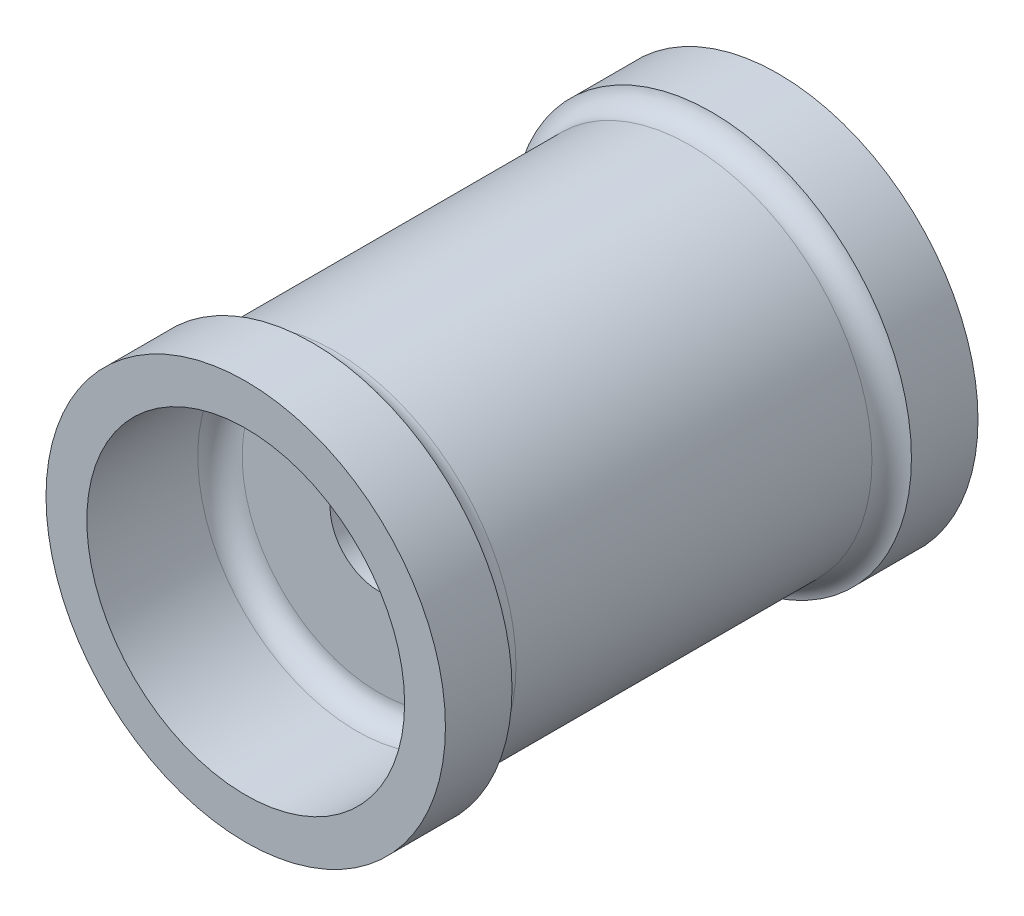
from build123d import *

# Parameters (mm, degrees)
SZKIC1_R                    = 8.2
SZKIC1_R_2                  = 2.2
DODANIE_WYCI_GNI_CIE6_DEPTH = 18
SZKIC6_R                    = 9
SZKIC6_R_2                  = 2.2
DODANIE_WYCI_GNI_CIE7_DEPTH = 3
DODANIE_WYCI_GNI_CIE8_START = 3
SZKIC7_R                    = 9
SZKIC7_R_2                  = 2.2
DODANIE_WYCI_GNI_CIE8_DEPTH = 3
SZKIC8_R                    = 7.16
WYTNIJ_WYCI_GNI_CIE2_DEPTH  = 6
WYTNIJ_WYCI_GNI_CIE3_START  = -6
SZKIC9_R                    = 7.16
SZKIC9_R_2                  = 2.2
WYTNIJ_WYCI_GNI_CIE3_DEPTH  = 6
ZAOKR_GLENIE2_R             = 1
ZAOKR_GLENIE3_R             = 1
ZAOKR_GLENIE4_R             = 1


with BuildPart() as part:
    # Szkic1 → Dodanie-wyciągnięcie6 (new body)
    with BuildSketch(Plane.XY):
        Circle(SZKIC1_R)
        Circle(SZKIC1_R_2, mode=Mode.SUBTRACT)
    extrude(amount=DODANIE_WYCI_GNI_CIE6_DEPTH)

    # Szkic6 → Dodanie-wyciągnięcie7 (add)
    with BuildSketch(Plane.XY.offset(18)):
        Circle(SZKIC6_R)
        Circle(SZKIC6_R_2, mode=Mode.SUBTRACT)
    extrude(amount=DODANIE_WYCI_GNI_CIE7_DEPTH)

    # Szkic7 → Dodanie-wyciągnięcie8 (add)
    with BuildSketch(Plane(origin=(0, 0, 0), x_dir=(-1, 0, 0), z_dir=(0, 0, -1)).offset(DODANIE_WYCI_GNI_CIE8_START)):
        with Locations(Location((0, 0, 0), (0, 0, 180))):
            Circle(SZKIC7_R)
        Circle(SZKIC7_R_2, mode=Mode.SUBTRACT)
    extrude(amount=-DODANIE_WYCI_GNI_CIE8_DEPTH)

    # Szkic8 → Wytnij-wyciągnięcie2 (cut)
    with BuildSketch(Plane(origin=(0, 0, -3), x_dir=(-1, 0, 0), z_dir=(0, 0, -1))):
        Circle(SZKIC8_R)
    extrude(amount=-WYTNIJ_WYCI_GNI_CIE2_DEPTH, mode=Mode.SUBTRACT)

    # Szkic9 → Wytnij-wyciągnięcie3 (cut)
    with BuildSketch(Plane.XY.offset(21).offset(WYTNIJ_WYCI_GNI_CIE3_START)):
        with Locations(Location((0, 0, 0), (0, 0, 180))):
            Circle(SZKIC9_R)
        with Locations(Location((0, 0, 0), (0, 0, 180))):
            Circle(SZKIC9_R_2, mode=Mode.SUBTRACT)
    extrude(amount=WYTNIJ_WYCI_GNI_CIE3_DEPTH, mode=Mode.SUBTRACT)

    # Zaokrąglenie2
    # the kernel refuses this fillet: 1 mm, written as the material it adds along each edge
    with BuildSketch(Plane(origin=(0, 0, 0), x_dir=(1, 0, 0), z_dir=(0, -1, 0))) as zaokr_glenie2_piece_1:
        with BuildLine():
            CenterArc((9.2, 0.979795897), ZAOKR_GLENIE2_R, 180, 78.463040967)
            Line((9, 0), (8.996, -0.019595918))
            ThreePointArc((8.996, -0.019595918), (8.6, -0.02), (8.2, -0.02))
            Line((8.2, -0.02), (8.18, 0))
            Line((8.18, 0), (8.18, 0.979795897))
            Line((8.18, 0.979795897), (8.2, 0.979795897))
        make_face()
    revolve(axis=Axis((0, 0, 0), (0, 0, 1)))
    with BuildSketch(Plane(origin=(0, 0, 18), x_dir=(1, 0, 0), z_dir=(0, -1, 0))) as zaokr_glenie2_piece_2:
        with BuildLine():
            CenterArc((9.2, -0.979795897), ZAOKR_GLENIE2_R, 101.536959033, 78.463040967)
            Line((9, 0), (8.996, 0.019595918))
            ThreePointArc((8.996, 0.019595918), (8.6, 0.02), (8.2, 0.02))
            Line((8.2, 0.02), (8.18, 0))
            Line((8.18, 0), (8.18, -0.979795897))
            Line((8.18, -0.979795897), (8.2, -0.979795897))
        make_face()
    revolve(axis=Axis((0, 0, 18), (0, 0, 1)))

    # Zaokrąglenie3
    zaokr_glenie3_edges = [part.edges().sort_by_distance(p)[0] for p in [
        (7.16, 0, 3),
    ]]
    fillet(zaokr_glenie3_edges, radius=ZAOKR_GLENIE3_R)

    # Zaokrąglenie4
    zaokr_glenie4_edges = [part.edges().sort_by_distance(p)[0] for p in [
        (7.16, 0, 15),
    ]]
    fillet(zaokr_glenie4_edges, radius=ZAOKR_GLENIE4_R)


solid = part.part
